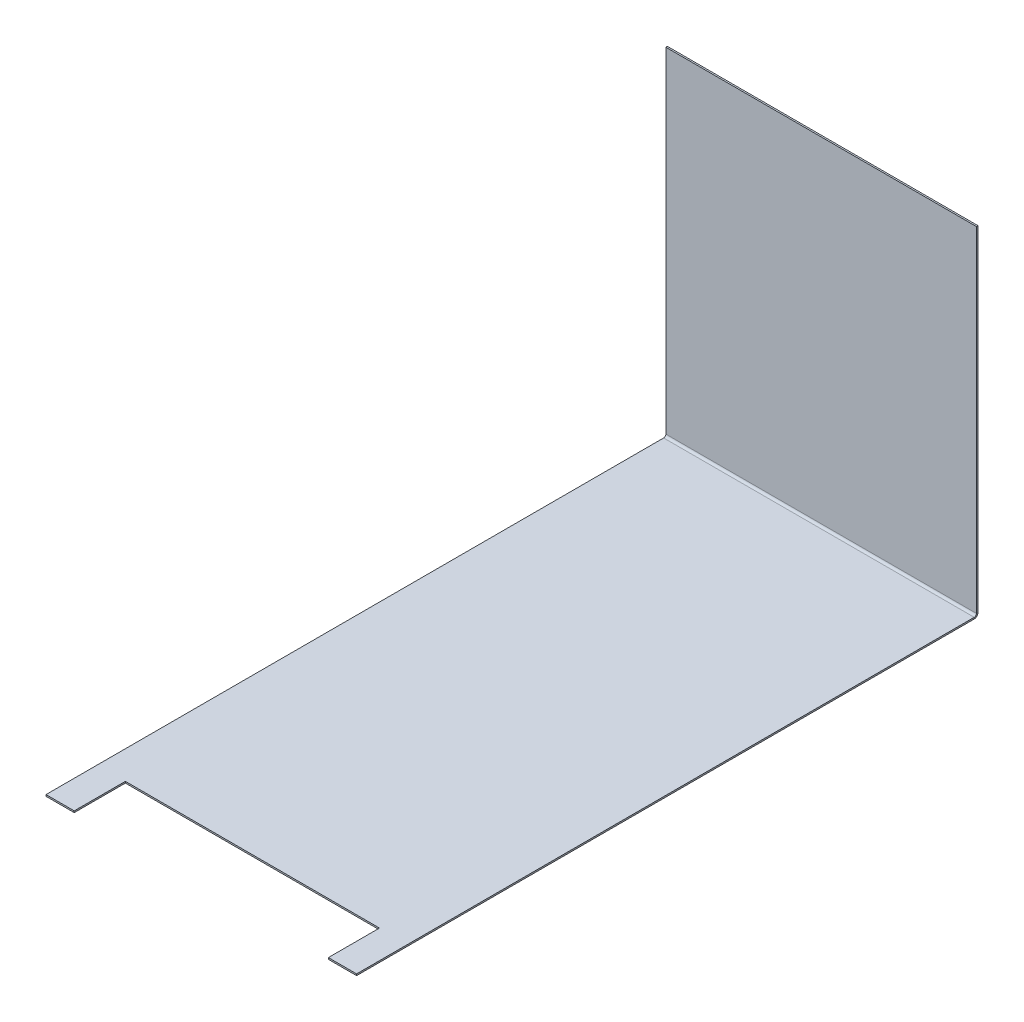
from build123d import *

# Parameters (mm, degrees)
SKETCH1_W          = 139.7
SKETCH1_H          = 254
BASE_FLANGE1_DEPTH = 0.7
EDGE_FLANGE1_DEPTH = 139.7
SKETCH9_W          = 12.7
SKETCH9_H          = 23
TAB1_DEPTH         = 0.7
SKETCH12_W         = 12.7
SKETCH12_H         = 23
TAB2_DEPTH         = 0.7


# Sheet-metal steps are written as plain solids
with BuildPart() as part:
    # Sketch1 → Base-Flange1 (new body)
    with BuildSketch(Plane(origin=(0, 0, 0), x_dir=(1, 0, 0), z_dir=(0, 1, 0))):
        Rectangle(SKETCH1_W, SKETCH1_H)
    extrude(amount=-BASE_FLANGE1_DEPTH)

    # Edge-Flange1 section (across the edge) → Edge-Flange1 (add)
    with BuildSketch(Plane(origin=(69.85, 0, -128.8), x_dir=(0, 0, 1), z_dir=(-1, 0, 0))):
        with BuildLine():
            Line((-0.7, 1), (-0.7, 151.7))
            Line((-0.7, 151.7), (0, 151.7))
            Line((0, 151.7), (0, 1))
            ThreePointArc((0, 1), (0.292893219, 0.292893219), (1, 0))
            Line((1, 0), (1.8, 0))
            Line((1.8, 0), (1.8, -0.7))
            Line((1.8, -0.7), (1, -0.7))
            ThreePointArc((1, -0.7), (-0.202081528, -0.202081528), (-0.7, 1))
        make_face()
    extrude(amount=EDGE_FLANGE1_DEPTH)

    # Sketch9 → Tab1 (add)
    with BuildSketch(Plane(origin=(0, 0, 0), x_dir=(1, 0, 0), z_dir=(0, 1, 0))):
        with Locations((-63.5, -138.5)):
            Rectangle(SKETCH9_W, SKETCH9_H)
    extrude(amount=-TAB1_DEPTH)

    # Sketch12 → Tab2 (add)
    with BuildSketch(Plane(origin=(0, 0, 0), x_dir=(1, 0, 0), z_dir=(0, 1, 0))):
        with Locations((63.5, -138.5)):
            Rectangle(SKETCH12_W, SKETCH12_H)
    extrude(amount=-TAB2_DEPTH)


solid = part.part
